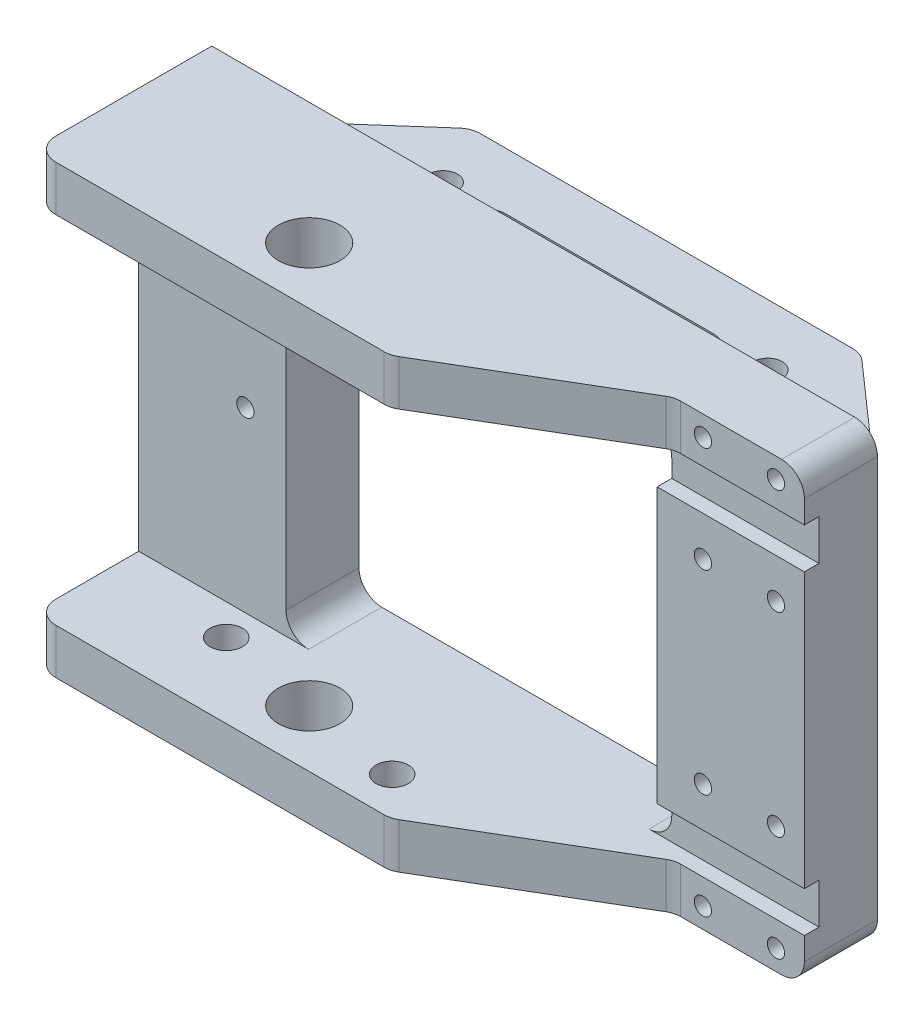
from build123d import *

# Parameters (mm, degrees)
SKETCH1_W                      = 104.14
SKETCH1_H                      = 69.85
BOSS_EXTRUDE1_DEPTH            = 23.495
SKETCH3_R                      = 4.826
PIVOT_POINTS_DEPTH             = 91.234818252
SKETCH17_W                     = 104.14
SKETCH17_H                     = 46.99
SKETCH17_H_2                   = 9.906
BOTTOM_CUTOUT_DEPTH            = 19.05
SIDE_CUTOUT_DEPTH              = 91.234818252
SKETCH20_W                     = 104.14
SKETCH20_H                     = 55.626
TOP_CUTOUT_DEPTH               = 16.51
CENTER_CUTOUT_REACH            = 71.714
SKETCH21_W                     = 58.071373626
SKETCH21_H                     = 55.626
F_8_CLEARANCE_HOLE1_D          = 4.4958
F_8_0_199_DIAMETER_HOLE1_D     = 5.0546
F_8_0_199_DIAMETER_HOLE1_DEPTH = 7.112
SKETCH30_W                     = 23.034313187
SKETCH30_H                     = 6.35
SPRING_CUTOUT_DEPTH            = 2.286
FILLET3_R                      = 3.556


# Read off the part's stored shape, not the designer's step: #6-32 Tapped Hole1
with BuildPart() as part:
    # Sketch1 → Boss-Extrude1 (new, symmetric)
    with BuildSketch(Plane.XY):
        Rectangle(SKETCH1_W, SKETCH1_H)
    extrude(amount=BOSS_EXTRUDE1_DEPTH, both=True)

    # Sketch3 → Pivot Points (cut, through all)
    with BuildSketch(Plane.XZ.offset(34.925)):
        with Locations((-17.78, 14.605)):
            Circle(SKETCH3_R)
    extrude(amount=-PIVOT_POINTS_DEPTH, mode=Mode.SUBTRACT)

    # Sketch17 → Bottom Cutout (cut)
    with BuildSketch(Plane(origin=(0, 0, -23.495), x_dir=(-1, 0, 0), z_dir=(0, 0, -1))):
        with Locations((0, -11.43)):
            Rectangle(SKETCH17_W, SKETCH17_H)
        with Locations((0, 29.972)):
            Rectangle(SKETCH17_W, SKETCH17_H_2)
    extrude(amount=-BOTTOM_CUTOUT_DEPTH, mode=Mode.SUBTRACT)

    # Sketch18 → Side Cutout (cut, through all)
    with BuildSketch(Plane.XZ.offset(34.925)):
        Polygon((52.07, 6.985), (31.75, 6.985), (3.81, 23.495), (52.07, 23.495), align=None)
        Polygon((52.07, -4.445), (30.48, -23.495), (52.07, -23.495), align=None)
        Polygon((-52.07, -4.445), (-30.48, -23.495), (-52.07, -23.495), align=None)
        Polygon((-29.035686813, -4.445), (-17.521020146, -14.605), (17.521020146, -14.605), (29.035686813, -4.445), align=None)
    extrude(amount=-SIDE_CUTOUT_DEPTH, mode=Mode.SUBTRACT)

    # Sketch20 → Top Cutout (cut)
    with BuildSketch(Plane.XY.offset(23.495)):
        Rectangle(SKETCH20_W, SKETCH20_H)
    extrude(amount=-TOP_CUTOUT_DEPTH, mode=Mode.SUBTRACT)

    # Center Cutout: up to this face of the body (flat: up to its plane)
    center_cutout_end = Plane(part.part.faces().sort_by_distance((0, -1.657135224, -4.445))[0])
    # Sketch21 → Center Cutout (cut, up to the picked face)
    with BuildSketch(Plane.XY.offset(6.985), mode=Mode.PRIVATE) as center_cutout_sk1:
        Rectangle(SKETCH21_W, SKETCH21_H)
    center_cutout_tool1 = split(extrude(center_cutout_sk1.sketch, amount=-CENTER_CUTOUT_REACH, mode=Mode.PRIVATE), bisect_by=center_cutout_end, keep=Keep.BOTH, mode=Mode.PRIVATE)
    add(center_cutout_tool1.solids().sort_by(Axis((0, 0, 6.985), (0, 0, -1)))[0], mode=Mode.SUBTRACT)

    # #8 Clearance Hole1 (through all)
    with Locations(Plane(origin=(0, 25.019, 0), x_dir=(1, 0, 0), z_dir=(0, 1, 0))):
        with Locations((25.4, 13.97), (-25.4, 13.97)):
            Hole(F_8_CLEARANCE_HOLE1_D / 2)

    # #8 (0.199) Diameter Hole1
    with Locations(Plane(origin=(0, -34.925, 0), x_dir=(-1, 0, 0), z_dir=(0, -1, 0))):
        with Locations((17.78, -14.605), (2.021106336, -17.383718139), (33.538893664, -11.826281861)):
            Hole(F_8_0_199_DIAMETER_HOLE1_D / 2, depth=F_8_0_199_DIAMETER_HOLE1_DEPTH)

    # Sketch30 → Spring Cutout (cut)
    with BuildSketch(Plane.XY.offset(6.985)):
        with Locations((40.552843407, 24.638)):
            Rectangle(SKETCH30_W, SKETCH30_H)
        with Locations((40.552843407, -24.638)):
            Rectangle(SKETCH30_W, SKETCH30_H)
    extrude(amount=-SPRING_CUTOUT_DEPTH, mode=Mode.SUBTRACT)

    # #6-32 Tapped Hole1 outline → #6-32 Tapped Hole1 (revolve, cut)
    with BuildSketch(Plane(origin=(36.195, -31.75, 0), x_dir=(1, 0, 0), z_dir=(0, -1, 0))):
        Polygon((0, 6.985), (0, -3.22569403), (1.35255, -2.413), (1.35255, 6.985), align=None)
    revolve(axis=Axis((36.195, -31.75, 0), (0, 0, 1)), mode=Mode.SUBTRACT)

    # 6-32 Tapped Hole1 2 outline → 6-32 Tapped Hole1 2 (revolve, cut)
    with BuildSketch(Plane(origin=(36.195, -15.24, 0), x_dir=(1, 0, 0), z_dir=(0, -1, 0))):
        Polygon((0, 6.985), (0, -3.22569403), (1.35255, -2.413), (1.35255, 6.985), align=None)
    revolve(axis=Axis((36.195, -15.24, 0), (0, 0, 1)), mode=Mode.SUBTRACT)

    # 6-32 Tapped Hole1 3 outline → 6-32 Tapped Hole1 3 (revolve, cut)
    with BuildSketch(Plane(origin=(47.625, -15.24, 0), x_dir=(1, 0, 0), z_dir=(0, -1, 0))):
        Polygon((0, 6.985), (0, -3.22569403), (1.35255, -2.413), (1.35255, 6.985), align=None)
    revolve(axis=Axis((47.625, -15.24, 0), (0, 0, 1)), mode=Mode.SUBTRACT)

    # 6-32 Tapped Hole1 4 outline → 6-32 Tapped Hole1 4 (revolve, cut)
    with BuildSketch(Plane(origin=(47.625, -31.75, 0), x_dir=(1, 0, 0), z_dir=(0, -1, 0))):
        Polygon((0, 6.985), (0, -3.22569403), (1.35255, -2.413), (1.35255, 6.985), align=None)
    revolve(axis=Axis((47.625, -31.75, 0), (0, 0, 1)), mode=Mode.SUBTRACT)

    # 6-32 Tapped Hole1 5 outline → 6-32 Tapped Hole1 5 (revolve, cut)
    with BuildSketch(Plane(origin=(47.625, 31.75, 0), x_dir=(1, 0, 0), z_dir=(0, -1, 0))):
        Polygon((0, 6.985), (0, -3.22569403), (1.35255, -2.413), (1.35255, 6.985), align=None)
    revolve(axis=Axis((47.625, 31.75, 0), (0, 0, 1)), mode=Mode.SUBTRACT)

    # 6-32 Tapped Hole1 6 outline → 6-32 Tapped Hole1 6 (revolve, cut)
    with BuildSketch(Plane(origin=(36.195, 15.24, 0), x_dir=(1, 0, 0), z_dir=(0, -1, 0))):
        Polygon((0, 6.985), (0, -3.22569403), (1.35255, -2.413), (1.35255, 6.985), align=None)
    revolve(axis=Axis((36.195, 15.24, 0), (0, 0, 1)), mode=Mode.SUBTRACT)

    # 6-32 Tapped Hole1 7 outline → 6-32 Tapped Hole1 7 (revolve, cut)
    with BuildSketch(Plane(origin=(47.625, 15.24, 0), x_dir=(1, 0, 0), z_dir=(0, -1, 0))):
        Polygon((0, 6.985), (0, -3.22569403), (1.35255, -2.413), (1.35255, 6.985), align=None)
    revolve(axis=Axis((47.625, 15.24, 0), (0, 0, 1)), mode=Mode.SUBTRACT)

    # 6-32 Tapped Hole1 8 outline → 6-32 Tapped Hole1 8 (revolve, cut)
    with BuildSketch(Plane(origin=(36.195, 31.75, 0), x_dir=(1, 0, 0), z_dir=(0, -1, 0))):
        Polygon((0, 6.985), (0, -3.22569403), (1.35255, -2.413), (1.35255, 6.985), align=None)
    revolve(axis=Axis((36.195, 31.75, 0), (0, 0, 1)), mode=Mode.SUBTRACT)

    # 6-32 Tapped Hole1 9 outline → 6-32 Tapped Hole1 9 (revolve, cut)
    with BuildSketch(Plane(origin=(-35.385686813, 0, 0), x_dir=(1, 0, 0), z_dir=(0, -1, 0))):
        Polygon((0, 6.985), (0, -3.22569403), (1.35255, -2.413), (1.35255, 6.985), align=None)
    revolve(axis=Axis((-35.385686813, 0, 0), (0, 0, 1)), mode=Mode.SUBTRACT)

    # Fillet3
    # the kernel refuses this fillet: 3.556 mm, written as the material it adds along each edge
    with BuildSketch(Plane(origin=(31.75, -34.925, 6.985), x_dir=(1, 0, 0), z_dir=(0, 1, 0)), Plane(origin=(31.75, 27.813, 6.985), x_dir=(1, 0, 0), z_dir=(0, 1, 0))) as fillet3_piece_1:
        with BuildLine():
            CenterArc((FILLET3_R * 0.273374206028, -FILLET3_R), FILLET3_R, 90, 30.579226872)
            Line((-FILLET3_R * 0.235355106099, -FILLET3_R * 0.139073471786), (0, 0))
            Line((0, 0), (FILLET3_R * 0.273374206028, 0))
        make_face()
    extrude(amount=7.112)
    with BuildSketch(Plane(origin=(29.035686813, -27.813, 4.699), x_dir=(-1, 0, 0), z_dir=(0, 0, -1))) as fillet3_piece_2:
        with BuildLine():
            CenterArc((FILLET3_R, FILLET3_R), FILLET3_R, 180, 90)
            Line((0, FILLET3_R), (0, 0))
            Line((0, 0), (FILLET3_R, 0))
        make_face()
    extrude(amount=9.144)
    with BuildSketch(Plane(origin=(29.035686813, 27.813, 4.699), x_dir=(-1, 0, 0), z_dir=(0, 0, -1))) as fillet3_piece_3:
        with BuildLine():
            CenterArc((FILLET3_R, -FILLET3_R), FILLET3_R, 90, 90)
            Line((0, -FILLET3_R), (0, 0))
            Line((0, 0), (FILLET3_R, 0))
        make_face()
    extrude(amount=9.144)
    with BuildSketch(Plane(origin=(29.035686813, 27.813, 4.699), x_dir=(-1, 0, 0), z_dir=(0, 0, -1))) as fillet3_piece_4_section:
        with BuildLine():
            CenterArc((FILLET3_R, -FILLET3_R), FILLET3_R, 90, 90)
            Line((0, -FILLET3_R), (0, 0))
            Line((0, 0), (FILLET3_R, 0))
        make_face()
    fillet3_piece_4 = extrude(amount=18.034, mode=Mode.PRIVATE)
    fillet3_piece_4 = split(fillet3_piece_4, bisect_by=Plane(origin=(28.996396746, 25.019, -4.462333853), z_dir=(0, -1, 0)), keep=Keep.TOP, mode=Mode.PRIVATE)
    add(fillet3_piece_4)
    with BuildSketch(Plane(origin=(-29.035686813, 27.813, 6.985), x_dir=(1, 0, 0), z_dir=(0, 0, -1))) as fillet3_piece_5:
        with BuildLine():
            CenterArc((FILLET3_R, FILLET3_R), FILLET3_R, 180, 90)
            Line((0, FILLET3_R), (0, 0))
            Line((0, 0), (FILLET3_R, 0))
        make_face()
    extrude(amount=11.43)
    with BuildSketch(Plane(origin=(-29.035686813, 27.813, 6.985), x_dir=(1, 0, 0), z_dir=(0, 0, -1))) as fillet3_piece_6_section:
        with BuildLine():
            CenterArc((FILLET3_R, FILLET3_R), FILLET3_R, 180, 90)
            Line((0, FILLET3_R), (0, 0))
            Line((0, 0), (FILLET3_R, 0))
        make_face()
    fillet3_piece_6 = extrude(amount=20.32, mode=Mode.PRIVATE)
    fillet3_piece_6 = split(fillet3_piece_6, bisect_by=Plane(origin=(-28.996396746, 25.019, -4.462333853), z_dir=(0, -1, 0)), keep=Keep.TOP, mode=Mode.PRIVATE)
    add(fillet3_piece_6)
    with BuildSketch(Plane(origin=(-29.035686813, -27.813, 6.985), x_dir=(1, 0, 0), z_dir=(0, 0, -1))) as fillet3_piece_7:
        with BuildLine():
            CenterArc((FILLET3_R, -FILLET3_R), FILLET3_R, 90, 90)
            Line((0, -FILLET3_R), (0, 0))
            Line((0, 0), (FILLET3_R, 0))
        make_face()
    extrude(amount=11.43)
    with BuildSketch(Plane(origin=(17.521020146, 12.065, -14.605), x_dir=(-1, 0, 0), z_dir=(0, 1, 0)), Plane(origin=(-17.521020146, 12.065, -14.605), x_dir=(-0.7498378553650912, 0, 0.6616216370868477), z_dir=(0, 1, 0))) as fillet3_piece_8:
        with BuildLine():
            CenterArc((FILLET3_R * 0.378104539834, FILLET3_R), FILLET3_R, 228.576334375, 41.423665625)
            Line((-FILLET3_R * 0.283517097253, FILLET3_R * 0.250162144635), (0, 0))
            Line((0, 0), (FILLET3_R * 0.378104539834, 0))
        make_face()
    extrude(amount=12.954)
    # the kernel refuses this fillet: 3.556 mm, written as the material it takes off along each edge
    with BuildSketch(Plane(origin=(3.81, -37.355296692, 23.495), x_dir=(-1, 0, 0), z_dir=(0, 1, 0))) as fillet3_2_piece_1:
        with BuildLine():
            CenterArc((FILLET3_R * 0.273374206028, -FILLET3_R), FILLET3_R, 90, 30.579226872)
            Line((-FILLET3_R * 0.235355106099, -FILLET3_R * 0.139073471786), (0, 0))
            Line((0, 0), (FILLET3_R * 0.273374206028, 0))
        make_face()
    extrude(amount=11.972593383, mode=Mode.SUBTRACT)
    with BuildSketch(Plane(origin=(-52.07, -18.923, 23.495), x_dir=(1, 0, 0), z_dir=(0, -1, 0)), Plane(origin=(-52.07, 43.815, 23.495), x_dir=(1, 0, 0), z_dir=(0, -1, 0))) as fillet3_2_piece_2:
        with BuildLine():
            CenterArc((FILLET3_R, -FILLET3_R), FILLET3_R, 90, 90)
            Line((0, -FILLET3_R), (0, 0))
            Line((0, 0), (FILLET3_R, 0))
        make_face()
    extrude(amount=24.892, mode=Mode.SUBTRACT)
    with BuildSketch(Plane(origin=(52.07, 34.925, 15.875), x_dir=(-1, 0, 0), z_dir=(0, 0, -1))) as fillet3_2_piece_3:
        with BuildLine():
            CenterArc((FILLET3_R, -FILLET3_R), FILLET3_R, 90, 90)
            Line((0, -FILLET3_R), (0, 0))
            Line((0, 0), (FILLET3_R, 0))
        make_face()
    extrude(amount=29.21, mode=Mode.SUBTRACT)
    with BuildSketch(Plane(origin=(52.07, -34.925, 15.875), x_dir=(-1, 0, 0), z_dir=(0, 0, -1))) as fillet3_2_piece_4:
        with BuildLine():
            CenterArc((FILLET3_R, FILLET3_R), FILLET3_R, 180, 90)
            Line((0, FILLET3_R), (0, 0))
            Line((0, 0), (FILLET3_R, 0))
        make_face()
    extrude(amount=29.21, mode=Mode.SUBTRACT)
    with BuildSketch(Plane(origin=(3.81, 25.382703308, 23.495), x_dir=(0.8609265282143158, 0, -0.5087293121266405), z_dir=(0, 1, 0))) as fillet3_2_piece_5:
        with BuildLine():
            CenterArc((FILLET3_R * 0.273374206028, FILLET3_R), FILLET3_R, 239.420773128, 30.579226872)
            Line((-FILLET3_R * 0.235355106099, FILLET3_R * 0.139073471786), (0, 0))
            Line((0, 0), (FILLET3_R * 0.273374206028, 0))
        make_face()
    extrude(amount=11.972593383, mode=Mode.SUBTRACT)
    with BuildSketch(Plane(origin=(-30.48, 8.703650641, -23.495), x_dir=(-0.7498378553650943, 0, 0.6616216370868445), z_dir=(0, 1, 0))) as fillet3_2_piece_6:
        with BuildLine():
            CenterArc((FILLET3_R * 0.378104539834, FILLET3_R), FILLET3_R, 228.576334375, 41.423665625)
            Line((-FILLET3_R * 0.283517097253, FILLET3_R * 0.250162144635), (0, 0))
            Line((0, 0), (FILLET3_R * 0.378104539834, 0))
        make_face()
    extrude(amount=19.676698718, mode=Mode.SUBTRACT)
    with BuildSketch(Plane(origin=(30.48, 8.703650641, -23.495), x_dir=(0.7498378553650921, 0, 0.6616216370868468), z_dir=(0, 1, 0))) as fillet3_2_piece_7:
        with BuildLine():
            CenterArc((FILLET3_R * 0.378104539834, -FILLET3_R), FILLET3_R, 90, 41.423665625)
            Line((-FILLET3_R * 0.283517097253, -FILLET3_R * 0.250162144635), (0, 0))
            Line((0, 0), (FILLET3_R * 0.378104539834, 0))
        make_face()
    extrude(amount=19.676698718, mode=Mode.SUBTRACT)


solid = part.part
